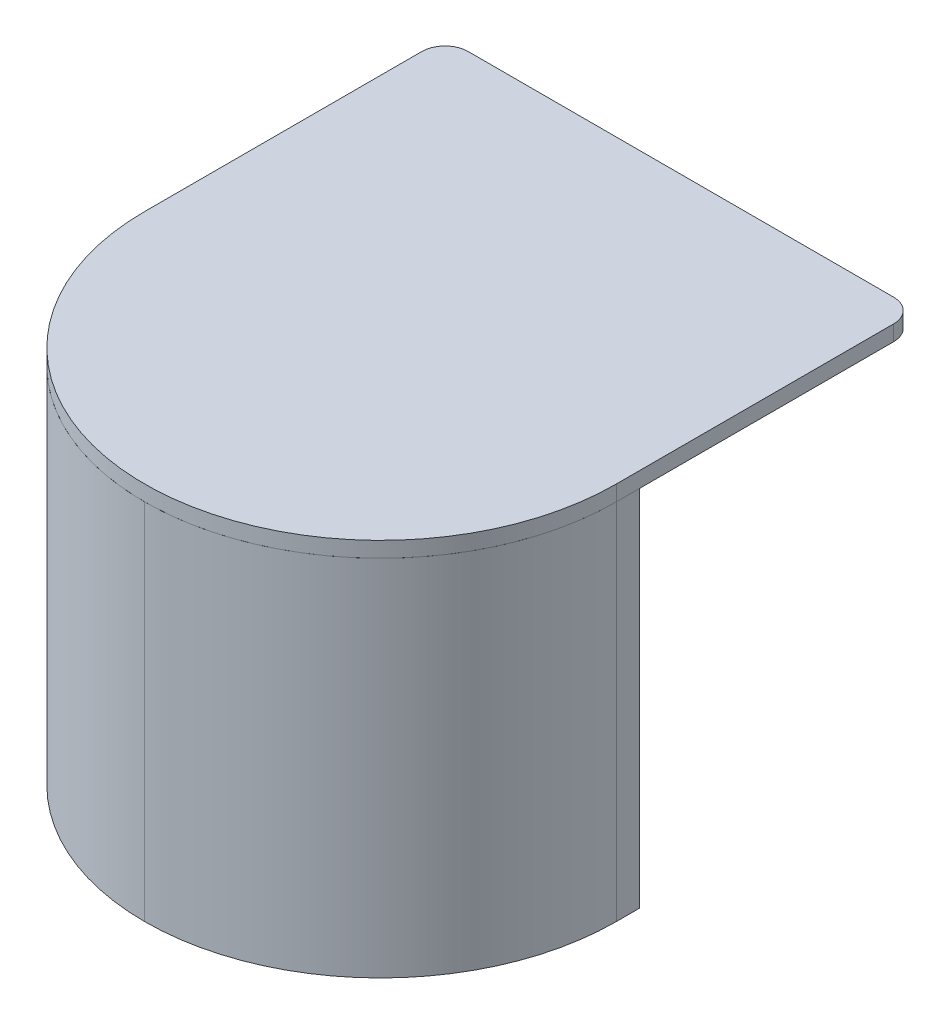
from build123d import *

# Parameters (mm, degrees)
SKETCH_1_W          = 61
SKETCH_1_H          = 33.5
EXTRUDE_1_DEPTH     = 50
SKETCH_2_W          = 55
SKETCH_2_H          = 44
CUT_EXTRUDE_1_DEPTH = 30.5
FILLET_3_R          = 27.5
FILLET_4_R          = 30.5
SKETCH_3_R          = 23.5
CUT_EXTRUDE_2_DEPTH = 30.5
SKETCH_5_R          = 16
CUT_EXTRUDE_4_DEPTH = 30.5
FILLET_5_R          = 4
FILLET_6_R          = 2
SKETCH_6_W          = 61
SKETCH_6_H          = 3
CUT_EXTRUDE_5_DEPTH = 400
SKETCH_8_W          = 55
SKETCH_8_H          = 3
SKETCH_8_W_2        = 3
EXTRUDE_2_DEPTH     = 2
FILLET_7_R          = 3


with BuildPart() as part:
    # 스케치1 → 보스-돌출1 (new body)
    with BuildSketch(Plane(origin=(0, 0, 0), x_dir=(1, 0, 0), z_dir=(0, 1, 0))):
        Rectangle(SKETCH_1_W, SKETCH_1_H)
    extrude(amount=EXTRUDE_1_DEPTH)

    # 스케치2 → 컷-돌출1 (cut)
    with BuildSketch(Plane(origin=(0, 0, -16.75), x_dir=(-1, 0, 0), z_dir=(0, 0, -1))):
        with Locations((0, 25)):
            Rectangle(SKETCH_2_W, SKETCH_2_H)
    extrude(amount=-CUT_EXTRUDE_1_DEPTH, mode=Mode.SUBTRACT)

    # 필렛3
    fillet_3_edges = [part.edges().sort_by_distance(p)[0] for p in [
        (-27.5, 25, 13.75),
        (27.5, 25, 13.75),
    ]]
    fillet(fillet_3_edges, radius=FILLET_3_R - 0.0001)  # a hair under: the kernel refuses the full size

    # 필렛4
    fillet_4_edges = [part.edges().sort_by_distance(p)[0] for p in [
        (-30.5, 25, 16.75),
        (30.5, 25, 16.75),
    ]]
    fillet(fillet_4_edges, radius=FILLET_4_R - 0.0001)  # a hair under: the kernel refuses the full size

    # 스케치3 → 컷-돌출2 (cut)
    with BuildSketch(Plane.XZ):
        with Locations((0, -13.75)):
            Circle(SKETCH_3_R)
    extrude(amount=-CUT_EXTRUDE_2_DEPTH, mode=Mode.SUBTRACT)

    # 스케치5 → 컷-돌출4 (cut)
    with BuildSketch(Plane.XZ.offset(-47)):
        with Locations((0, -13.75)):
            Circle(SKETCH_5_R)
    extrude(amount=-CUT_EXTRUDE_4_DEPTH, mode=Mode.SUBTRACT)

    # 필렛5
    fillet_5_edges = [part.edges().sort_by_distance(p)[0] for p in [
        (-15.716233646, 48.5, -16.75),
        (15.716233646, 48.5, -16.75),
    ]]
    fillet(fillet_5_edges, radius=FILLET_5_R)

    # 필렛6
    fillet_6_edges = [part.edges().sort_by_distance(p)[0] for p in [
        (-23.307724042, 1.5, -16.75),
        (23.307724042, 1.5, -16.75),
    ]]
    fillet(fillet_6_edges, radius=FILLET_6_R)

    # 스케치6 → 컷-돌출5 (cut)
    with BuildSketch(Plane(origin=(0, 0, -16.75), x_dir=(-1, 0, 0), z_dir=(0, 0, -1))):
        with Locations((0, 48.5)):
            Rectangle(SKETCH_6_W, SKETCH_6_H)
    extrude(amount=-CUT_EXTRUDE_5_DEPTH, mode=Mode.SUBTRACT)


with BuildPart() as body_2:
    # 스케치8 → 보스-돌출2 (new body)
    with BuildSketch(Plane(origin=(0, 47, 0), x_dir=(1, 0, 0), z_dir=(0, 1, 0))):
        with BuildLine():
            Line((27.5, 13.75), (-27.5, 13.75))
            ThreePointArc((-27.5, 13.75), (-19.445436483, -5.695436483), (0, -13.75))
            ThreePointArc((0, -13.75), (19.445436483, -5.695436483), (27.5, 13.75))
        make_face()
        with Locations((0, 15.25)):
            Rectangle(SKETCH_8_W, SKETCH_8_H)
        Polygon((-30.5, 52.596597545), (-30.5, 16.75), (-27.5, 16.75), (27.5, 16.75), (30.5, 16.75), (30.5, 52.596597545), align=None)
        with BuildLine():
            Line((-27.5, 13.75), (-30.5, 13.75))
            ThreePointArc((-30.5, 13.75), (-21.566756826, -7.816756826), (0, -16.75))
            ThreePointArc((0, -16.75), (21.566756826, -7.816756826), (30.5, 13.75))
            Line((30.5, 13.75), (27.5, 13.75))
            ThreePointArc((27.5, 13.75), (19.445436483, -5.695436483), (0, -13.75))
            ThreePointArc((0, -13.75), (-19.445436483, -5.695436483), (-27.5, 13.75))
        make_face()
        with Locations((29, 15.25)):
            Rectangle(SKETCH_8_W_2, SKETCH_8_H)
        with Locations((-29, 15.25)):
            Rectangle(SKETCH_8_W_2, SKETCH_8_H)
    extrude(amount=EXTRUDE_2_DEPTH)

    # 필렛7
    fillet_7_edges = [body_2.edges().sort_by_distance(p)[0] for p in [
        (-30.5, 48, -52.596597545),
        (30.5, 48, -52.596597545),
    ]]
    fillet(fillet_7_edges, radius=FILLET_7_R)


solid = Compound([part.part, body_2.part])
